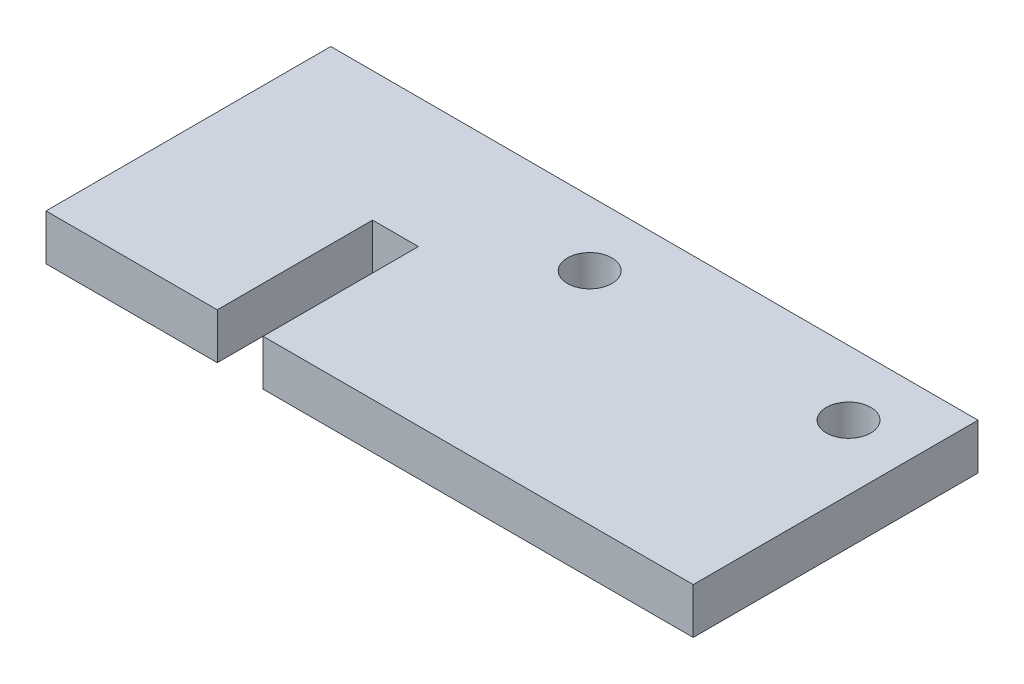
from build123d import *

# Parameters (mm, degrees)
SKETCH2_W                        = 63.5
SKETCH2_H                        = 27.94
BOSS_EXTRUDE1_DEPTH              = 4.4958
SKETCH3_W                        = 4.4958
SKETCH3_H                        = 15.24
CUT_EXTRUDE1_DEPTH               = 70.520542415
F_11_64_0_17188_DIAMETER_HOLE1_D = 4.365752


with BuildPart() as part:
    # Sketch2 → Boss-Extrude1 (new body)
    with BuildSketch(Plane(origin=(0, 0, 0), x_dir=(1, 0, 0), z_dir=(0, 1, 0))):
        with Locations((31.75, 13.97)):
            Rectangle(SKETCH2_W, SKETCH2_H)
    extrude(amount=BOSS_EXTRUDE1_DEPTH)

    # Sketch3 → Cut-Extrude1 (cut, through all)
    with BuildSketch(Plane.XZ):
        with Locations((19.05, -7.62)):
            Rectangle(SKETCH3_W, SKETCH3_H)
    extrude(amount=-CUT_EXTRUDE1_DEPTH, mode=Mode.SUBTRACT)

    # 11/64 (0.17188) Diameter Hole1 (through all)
    with Locations(Plane(origin=(0, 0, 0), x_dir=(-1, 0, 0), z_dir=(0, -1, 0))):
        with Locations((-31.75, 21.59), (-57.15, 21.59)):
            Hole(F_11_64_0_17188_DIAMETER_HOLE1_D / 2)


solid = part.part
